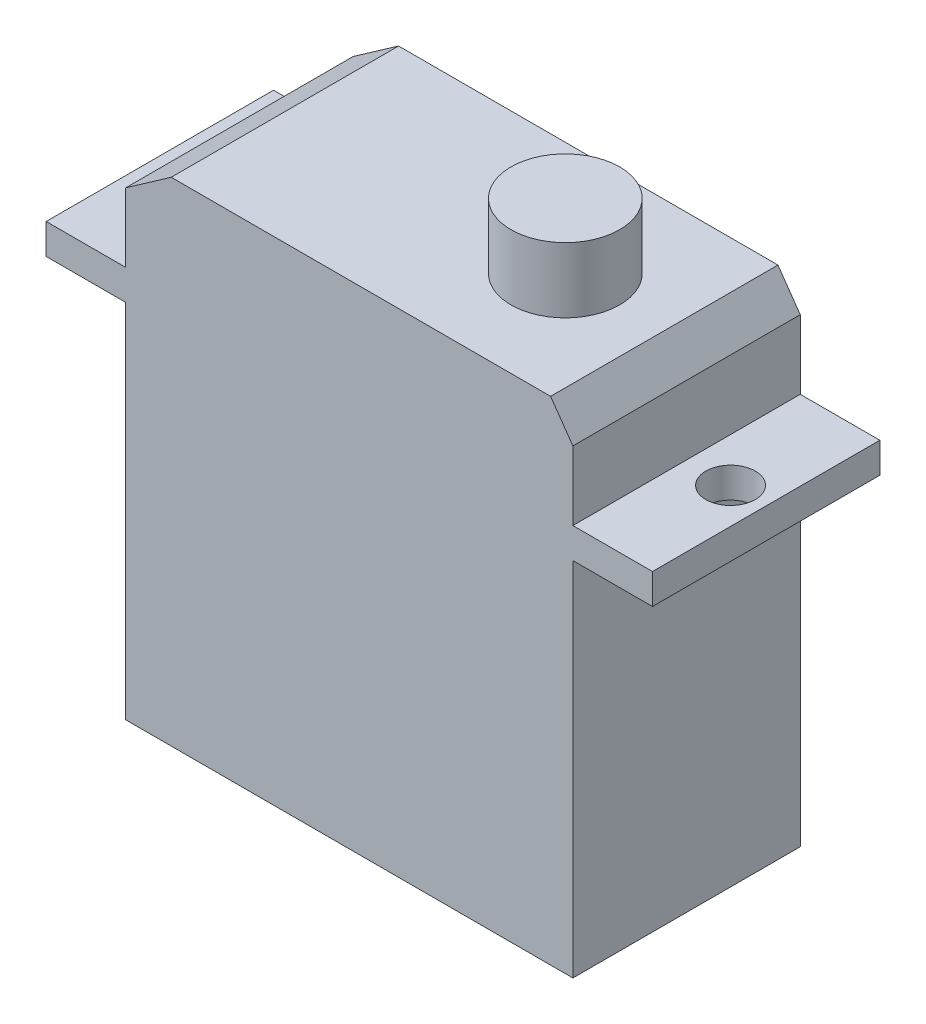
from build123d import *

# Parameters (mm, degrees)
BOSS_EXTRUDE1_DEPTH       = 7.5
SKETCH2_R                 = 3.587141307
BOSS_EXTRUDE2_DEPTH       = 4.3
F_4_CLEARANCE_HOLE1_D     = 3.2639
F_4_CLEARANCE_HOLE1_DEPTH = 5.84
F_4_CLEARANCE_HOLE1_TIP   = 0.980574487


with BuildPart() as part:
    # Sketch1 → Boss-Extrude1 (new, symmetric)
    with BuildSketch(Plane.XY):
        Polygon((-14.75, 11.925), (-20, 11.925), (-20, 13.925), (-14.75, 13.925), (-14.75, 18.474377385), (-11.75, 20.575), (13.27912821, 20.575), (14.75, 18.474377385), (14.75, 13.925), (20, 13.925), (20, 11.925), (14.75, 11.925), (14.75, -11.925), (-14.75, -11.925), align=None)
    extrude(amount=BOSS_EXTRUDE1_DEPTH, both=True)

    # Sketch2 → Boss-Extrude2 (add)
    with BuildSketch(Plane(origin=(0, 20.575, 0), x_dir=(1, 0, 0), z_dir=(0, 1, 0))):
        with Locations((6.75, 0)):
            Circle(SKETCH2_R)
    extrude(amount=BOSS_EXTRUDE2_DEPTH)

    # #4 Clearance Hole1
    with Locations(Plane(origin=(0, 13.925, 0), x_dir=(1, 0, 0), z_dir=(0, 1, 0))):
        with Locations((-17.65, 0), (17.65, 0)):
            Hole(F_4_CLEARANCE_HOLE1_D / 2, depth=F_4_CLEARANCE_HOLE1_DEPTH)
            with Locations((0, 0, -(F_4_CLEARANCE_HOLE1_DEPTH + F_4_CLEARANCE_HOLE1_TIP / 2))):  # 118° drill point
                Cone(0, F_4_CLEARANCE_HOLE1_D / 2, F_4_CLEARANCE_HOLE1_TIP, mode=Mode.SUBTRACT)


solid = part.part
